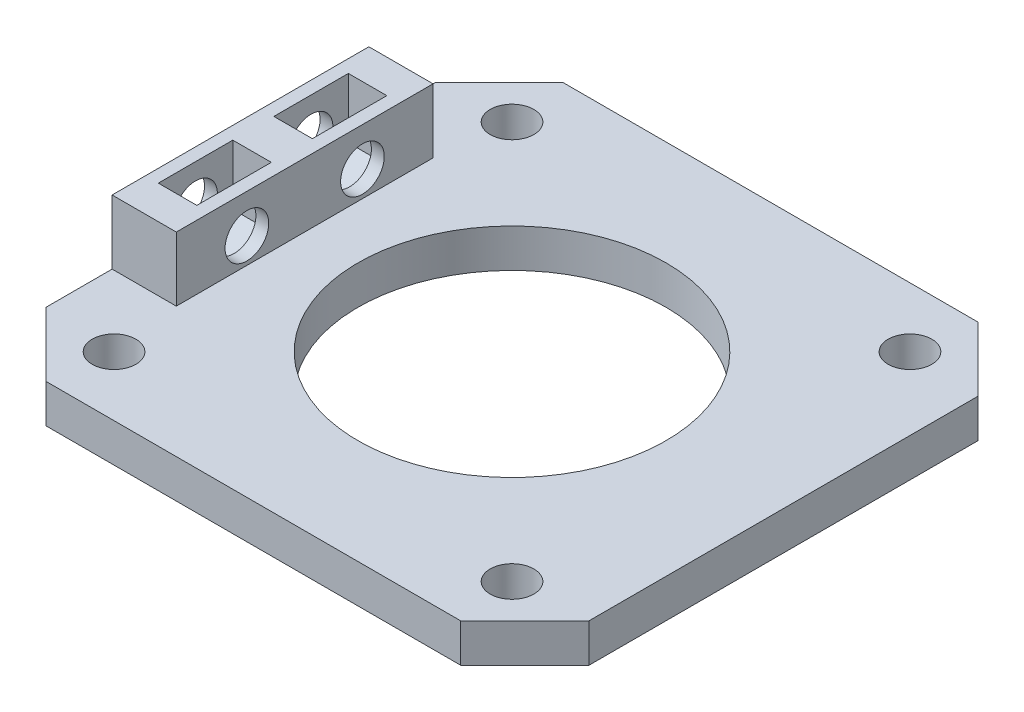
from build123d import *

# Parameters (mm, degrees)
CROQUIS1_W                 = 42.3
CROQUIS1_H                 = 40.3
CROQUIS1_R                 = 12
CROQUIS1_R_2               = 1.7
SALIENTE_EXTRUIR1_DEPTH    = 3
CHAFL_N2_SIZE              = 5
CHAFL_N3_SIZE              = 5
CHAFL_N4_SIZE              = 5
CHAFL_N5_SIZE              = 5
CROQUIS2_W                 = 5
CROQUIS2_H                 = 20
SALIENTE_EXTRUIR2_DEPTH    = 5
CROQUIS3_R                 = 1.7
CORTAR_EXTRUIR1_DEPTH      = 7
CORTAR_EXTRUIR2_DEPTH      = 1.5
CORTAR_EXTRUIR2_DEPTH_BACK = 1.5


with BuildPart() as part:
    # Croquis1 → Saliente-Extruir1 (new body)
    with BuildSketch(Plane(origin=(0, 0, 0), x_dir=(1, 0, 0), z_dir=(0, 1, 0))):
        Rectangle(CROQUIS1_W, CROQUIS1_H)
        Circle(CROQUIS1_R, mode=Mode.SUBTRACT)
        with Locations((-15.5, 15.5)):
            Circle(CROQUIS1_R_2, mode=Mode.SUBTRACT)
        with Locations((15.5, 15.5)):
            Circle(CROQUIS1_R_2, mode=Mode.SUBTRACT)
        with Locations((-15.5, -15.5)):
            Circle(CROQUIS1_R_2, mode=Mode.SUBTRACT)
        with Locations((15.5, -15.5)):
            Circle(CROQUIS1_R_2, mode=Mode.SUBTRACT)
    extrude(amount=SALIENTE_EXTRUIR1_DEPTH)

    # Chaflán2
    chafl_n2_edges = [part.edges().sort_by_distance(p)[0] for p in [
        (21.15, 1.5, -20.15),
    ]]
    chamfer(chafl_n2_edges, length=CHAFL_N2_SIZE)

    # Chaflán3
    chafl_n3_edges = [part.edges().sort_by_distance(p)[0] for p in [
        (21.15, 1.5, 20.15),
    ]]
    chamfer(chafl_n3_edges, length=CHAFL_N3_SIZE)

    # Chaflán4
    chafl_n4_edges = [part.edges().sort_by_distance(p)[0] for p in [
        (-21.15, 1.5, 20.15),
    ]]
    chamfer(chafl_n4_edges, length=CHAFL_N4_SIZE)

    # Chaflán5
    chafl_n5_edges = [part.edges().sort_by_distance(p)[0] for p in [
        (-21.15, 1.5, -20.15),
    ]]
    chamfer(chafl_n5_edges, length=CHAFL_N5_SIZE)

    # Croquis2 → Saliente-Extruir2 (add)
    with BuildSketch(Plane(origin=(0, 3, 0), x_dir=(1, 0, 0), z_dir=(0, 1, 0))):
        with Locations((-18.65, 0)):
            Rectangle(CROQUIS2_W, CROQUIS2_H)
    extrude(amount=SALIENTE_EXTRUIR2_DEPTH)

    # Croquis3 → Cortar-Extruir1 (cut)
    with BuildSketch(Plane.ZY.offset(21.15)):
        with Locations((-4.5, 5)):
            Circle(CROQUIS3_R)
        with Locations((4.5, 5)):
            Circle(CROQUIS3_R)
    extrude(amount=-CORTAR_EXTRUIR1_DEPTH, mode=Mode.SUBTRACT)

    # Croquis4 → Cortar-Extruir2 (cut, two sides: drawn at the far end of the back side and taken through both)
    with BuildSketch(Plane(origin=(-18.65, 0, 0), x_dir=(0, 0, -1), z_dir=(1, 0, 0)).offset(-CORTAR_EXTRUIR2_DEPTH_BACK)):
        Polygon((-7.401185103, 6.675), (-7.401185103, 13.325), (-1.598814897, 13.325), (-1.598814897, 6.675), (-1.598814897, 3.325), (-4.5, 1.65), (-7.401185103, 3.325), align=None)
        Polygon((1.598814897, 6.675), (1.598814897, 3.325), (4.5, 1.65), (7.401185103, 3.325), (7.401185103, 6.675), (7.401185103, 13.325), (1.598814897, 13.325), align=None)
    extrude(amount=CORTAR_EXTRUIR2_DEPTH + CORTAR_EXTRUIR2_DEPTH_BACK, mode=Mode.SUBTRACT)


solid = part.part
